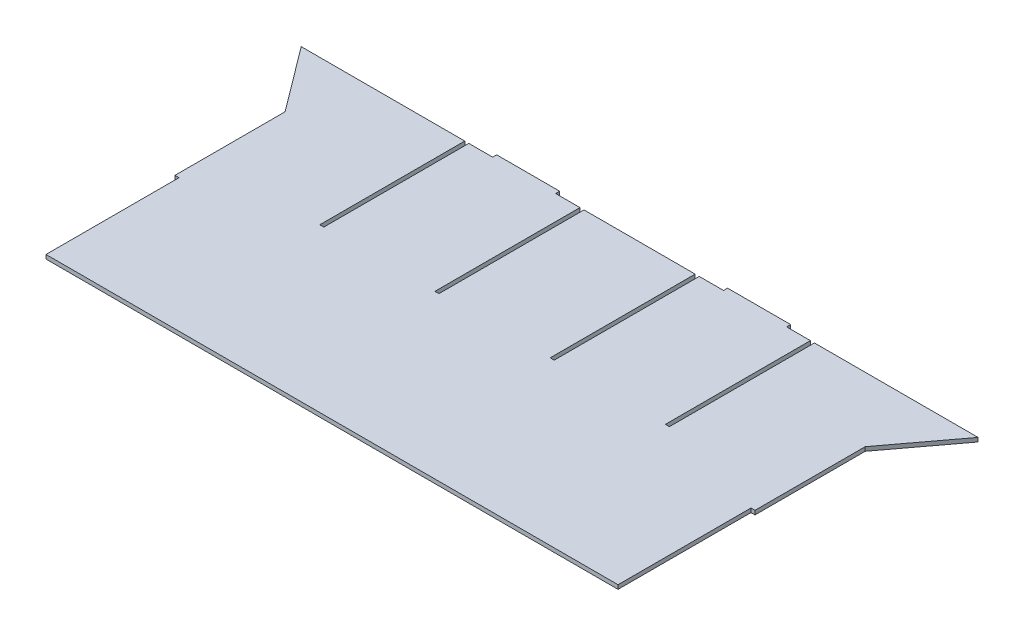
from build123d import *

# Parameters (mm, degrees)
SKETCH1_W           = 457.2020066
SKETCH1_H           = 3.175
BOSS_EXTRUDE1_DEPTH = 242.425000036
SKETCH2_W           = 3.175
SKETCH2_H           = 114.3
CUT_EXTRUDE1_DEPTH  = 334.224218774
LPATTERN1_COUNT     = 4
LPATTERN1_PITCH     = 90.807
SKETCH3_W           = 49.658811606
SKETCH3_H           = 3.175
BOSS_EXTRUDE2_DEPTH = 3.175
BOSS_EXTRUDE3_DEPTH = 3.175
SKETCH5_W           = 3.175
SKETCH5_H           = 104.775
CUT_EXTRUDE2_DEPTH  = 3.175


with BuildPart() as part:
    # Sketch1 → Boss-Extrude1 (new body)
    with BuildSketch(Plane.XY):
        Rectangle(SKETCH1_W, SKETCH1_H)
    extrude(amount=BOSS_EXTRUDE1_DEPTH)

    # Sketch2 → Cut-Extrude1 (cut, through all)
    with BuildSketch(Plane(origin=(0, 1.5875, 0), x_dir=(1, 0, 0), z_dir=(0, 1, 0))):
        with Locations((136.2085033, -57.15)):
            Rectangle(SKETCH2_W, SKETCH2_H)
    cut_extrude1 = extrude(amount=-CUT_EXTRUDE1_DEPTH, mode=Mode.SUBTRACT)

    # LPattern1: Cut-Extrude1 ×4
    with Locations(*[(-i * LPATTERN1_PITCH, 0, 0) for i in range(1, LPATTERN1_COUNT)]):
        add(cut_extrude1, mode=Mode.SUBTRACT)

    # Sketch3 → Boss-Extrude2 (add)
    with BuildSketch(Plane(origin=(0, 0, 0), x_dir=(-1, 0, 0), z_dir=(0, 0, -1))):
        with Locations((-91.020094169, 0)):
            Rectangle(SKETCH3_W, SKETCH3_H)
        with Locations((91.020094169, 0)):
            Rectangle(SKETCH3_W, SKETCH3_H)
    extrude(amount=BOSS_EXTRUDE2_DEPTH)

    # Sketch4 → Boss-Extrude3 (add)
    with BuildSketch(Plane.XZ.offset(1.5875)):
        Polygon((-228.6010033, 0), (-266.7010033, 0), (-228.6010033, 50.8), align=None)
    boss_extrude3 = extrude(amount=-BOSS_EXTRUDE3_DEPTH)

    # Mirror1: Boss-Extrude3 across plane
    add(boss_extrude3.mirror(Plane(origin=(0, 0, 0), x_dir=(0, 0, 1), z_dir=(1, 0, 0))))

    # Sketch5 → Cut-Extrude2 (cut)
    with BuildSketch(Plane.XZ.offset(1.5875)):
        with Locations((-227.0135033, 190.037500036)):
            Rectangle(SKETCH5_W, SKETCH5_H)
    cut_extrude2 = extrude(amount=-CUT_EXTRUDE2_DEPTH, mode=Mode.SUBTRACT)

    # Mirror2: Cut-Extrude2 across plane
    add(cut_extrude2.mirror(Plane(origin=(0, 0, 0), x_dir=(0, 0, 1), z_dir=(1, 0, 0))), mode=Mode.SUBTRACT)


solid = part.part
